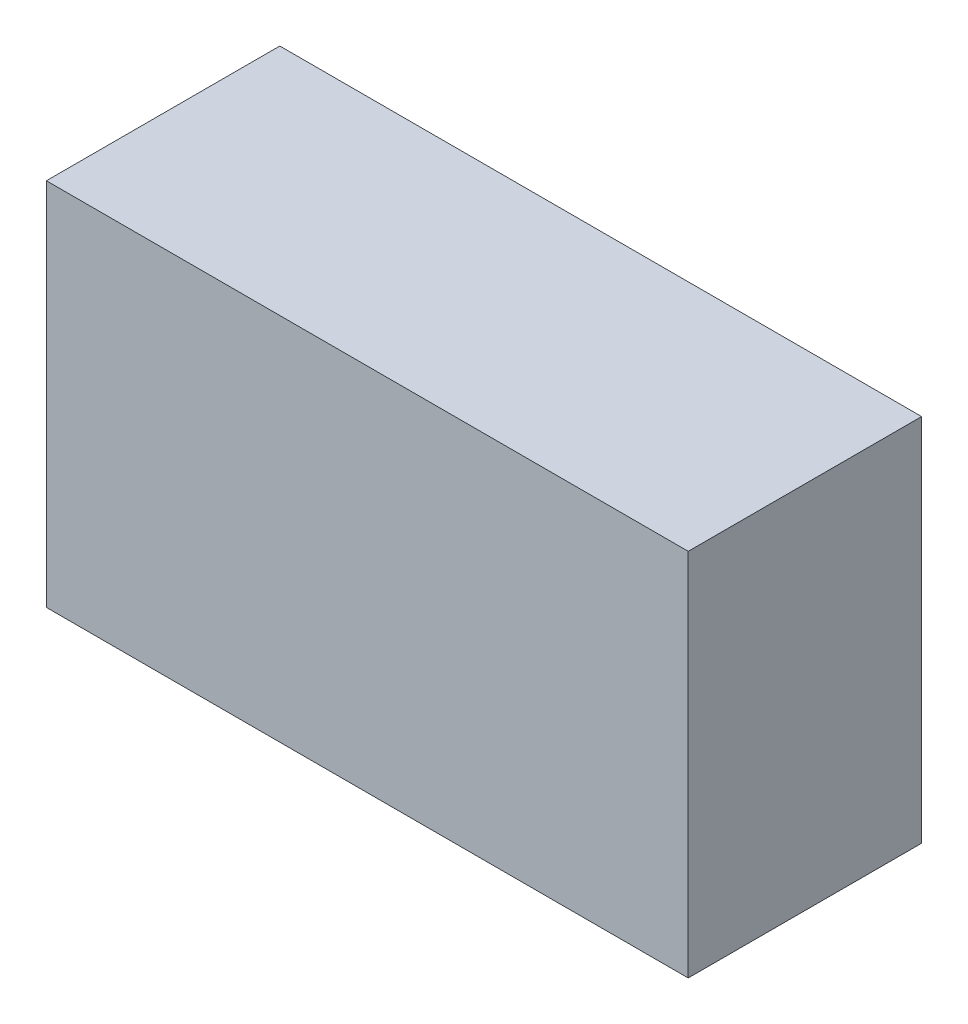
from build123d import *

# Parameters (mm, degrees)
SKETCH1_W           = 838.2
SKETCH1_H           = 482.6
BOSS_EXTRUDE1_DEPTH = 152.4


with BuildPart() as part:
    # Sketch1 → Boss-Extrude1 (new, symmetric)
    with BuildSketch(Plane.XY):
        Rectangle(SKETCH1_W, SKETCH1_H)
    extrude(amount=BOSS_EXTRUDE1_DEPTH, both=True)


solid = part.part
